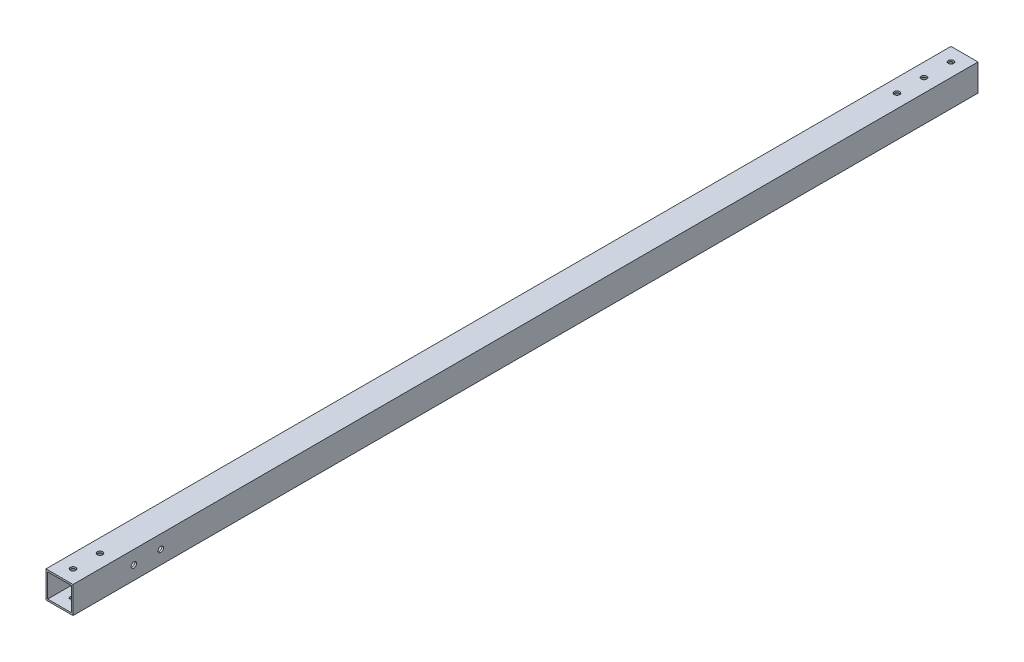
from build123d import *

# Parameters (mm, degrees)
SKETCH1_W           = 25.4
SKETCH1_H           = 25.4
SKETCH1_W_2         = 22.225
SKETCH1_H_2         = 22.225
BOSS_EXTRUDE1_DEPTH = 850.9
SKETCH3_R           = 2.54
CUT_EXTRUDE2_DEPTH  = 852.657871448
SKETCH4_R           = 2.54
CUT_EXTRUDE3_DEPTH  = 852.657871448


with BuildPart() as part:
    # Sketch1 → Boss-Extrude1 (new body)
    with BuildSketch(Plane.XY):
        with Locations((12.7, 12.7)):
            Rectangle(SKETCH1_W, SKETCH1_H)
        with Locations((12.7, 12.7)):
            Rectangle(SKETCH1_W_2, SKETCH1_H_2, mode=Mode.SUBTRACT)
    extrude(amount=BOSS_EXTRUDE1_DEPTH)

    # Sketch3 → Cut-Extrude2 (cut, through all)
    with BuildSketch(Plane(origin=(0, 25.4, 0), x_dir=(1, 0, 0), z_dir=(0, 1, 0))):
        with Locations((12.7, -812.8)):
            Circle(SKETCH3_R)
        with Locations((12.7, -838.2)):
            Circle(SKETCH3_R)
        with Locations((12.7, -12.7)):
            Circle(SKETCH3_R)
        with Locations((12.7, -38.1)):
            Circle(SKETCH3_R)
        with Locations((12.7, -63.5)):
            Circle(SKETCH3_R)
    extrude(amount=-CUT_EXTRUDE2_DEPTH, mode=Mode.SUBTRACT)

    # Sketch4 → Cut-Extrude3 (cut, through all)
    with BuildSketch(Plane(origin=(25.4, 0, 0), x_dir=(0, 0, -1), z_dir=(1, 0, 0))):
        with Locations((-793.75, 12.7)):
            Circle(SKETCH4_R)
        with Locations((-768.35, 12.7)):
            Circle(SKETCH4_R)
    extrude(amount=-CUT_EXTRUDE3_DEPTH, mode=Mode.SUBTRACT)


solid = part.part
